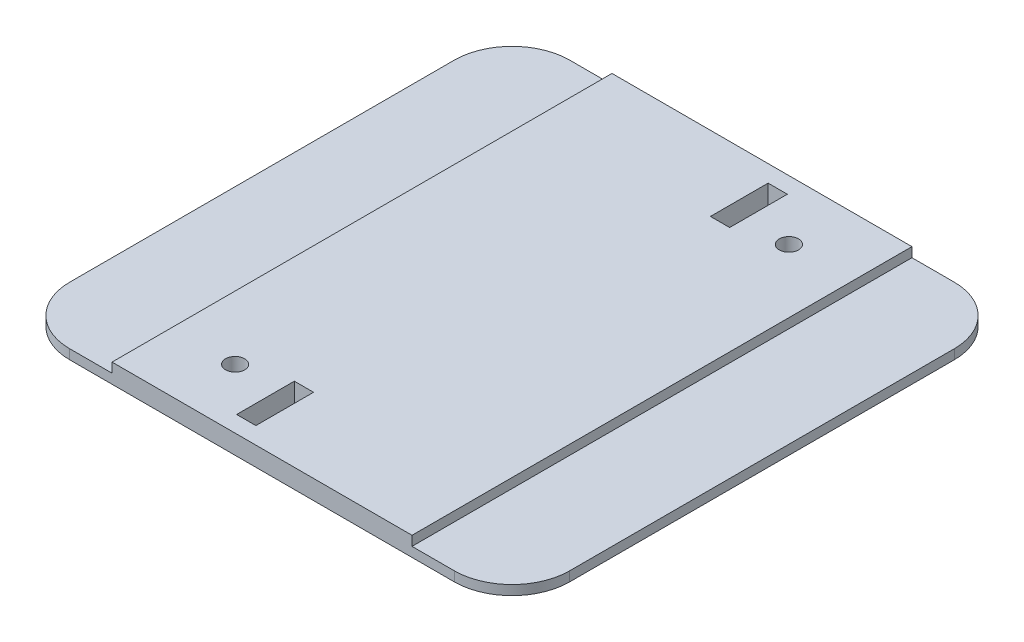
from build123d import *

# Parameters (mm, degrees)
SKETCH1_W           = 78
SKETCH1_H           = 130
BOSS_EXTRUDE1_DEPTH = 2.5
SKETCH4_W           = 130
SKETCH4_H           = 130
BOSS_EXTRUDE2_DEPTH = 2.5
SKETCH2_R           = 2.5
CUT_EXTRUDE1_DEPTH  = 10
CUT_EXTRUDE2_REACH  = 94.06
SKETCH3_W           = 5
SKETCH3_H           = 15
FILLET1_R           = 15


with BuildPart() as part:
    # Sketch1 → Boss-Extrude1 (new body)
    with BuildSketch(Plane(origin=(0, 0, 0), x_dir=(1, 0, 0), z_dir=(0, 1, 0))):
        Rectangle(SKETCH1_W, SKETCH1_H)
    extrude(amount=BOSS_EXTRUDE1_DEPTH)

    # Sketch4 → Boss-Extrude2 (add)
    with BuildSketch(Plane(origin=(0, 0, 0), x_dir=(-1, 0, 0), z_dir=(0, -1, 0))):
        Rectangle(SKETCH4_W, SKETCH4_H)
    extrude(amount=BOSS_EXTRUDE2_DEPTH)

    # Sketch2 → Cut-Extrude1 (cut)
    with BuildSketch(Plane(origin=(0, 2.5, 0), x_dir=(1, 0, 0), z_dir=(0, 1, 0))):
        with Locations((22.5, 49.5)):
            Circle(SKETCH2_R)
        with Locations((-22.5, -49.5)):
            Circle(SKETCH2_R)
    extrude(amount=-CUT_EXTRUDE1_DEPTH, mode=Mode.SUBTRACT)

    # Sketch3 → Cut-Extrude2 (cut, up to next)
    with BuildSketch(Plane(origin=(0, 2.5, 0), x_dir=(1, 0, 0), z_dir=(0, 1, 0)), mode=Mode.PRIVATE) as cut_extrude2_sk1:
        with Locations((8.5, 53.1)):
            Rectangle(SKETCH3_W, SKETCH3_H)
    cut_extrude2_tool1 = extrude(cut_extrude2_sk1.sketch, amount=-CUT_EXTRUDE2_REACH, mode=Mode.PRIVATE) & part.part
    # Sketch3 → Cut-Extrude2 (cut, up to next)
    with BuildSketch(Plane(origin=(0, 2.5, 0), x_dir=(1, 0, 0), z_dir=(0, 1, 0)), mode=Mode.PRIVATE) as cut_extrude2_sk2:
        with Locations((-8.5, -53.1)):
            Rectangle(SKETCH3_W, SKETCH3_H)
    cut_extrude2_tool2 = extrude(cut_extrude2_sk2.sketch, amount=-CUT_EXTRUDE2_REACH, mode=Mode.PRIVATE) & part.part
    add(cut_extrude2_tool1.solids().sort_by_distance((8.5, 2.5, -53.1))[0], mode=Mode.SUBTRACT)
    add(cut_extrude2_tool2.solids().sort_by_distance((-8.5, 2.5, 53.1))[0], mode=Mode.SUBTRACT)

    # Fillet1
    fillet1_edges = [part.edges().sort_by_distance(p)[0] for p in [
        (-65, -1.25, -65),
        (65, -1.25, -65),
        (65, -1.25, 65),
        (-65, -1.25, 65),
    ]]
    fillet(fillet1_edges, radius=FILLET1_R)


solid = part.part
